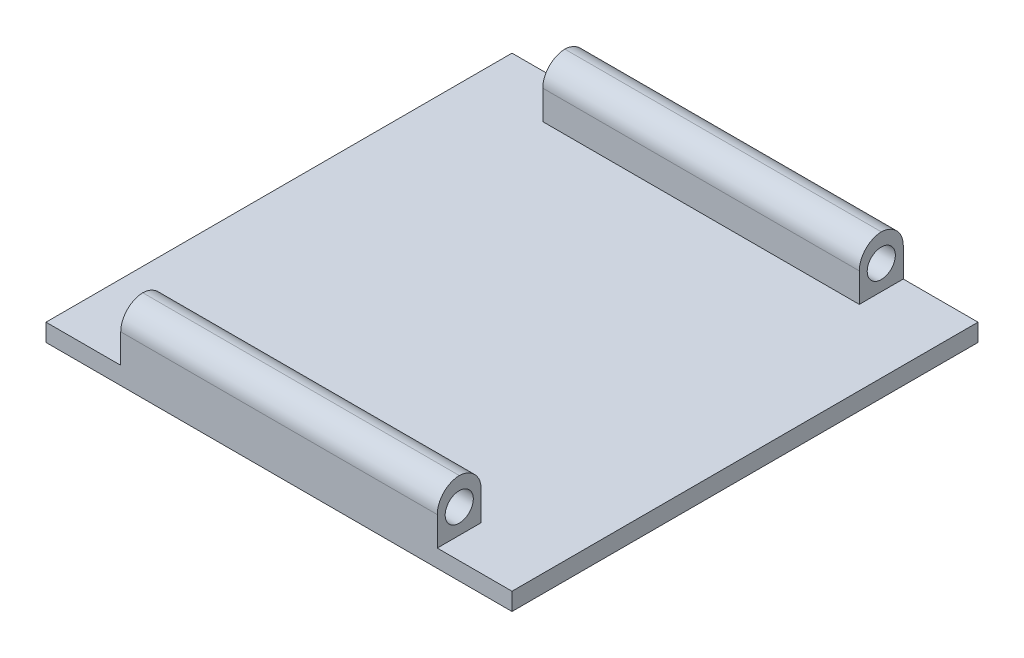
from build123d import *

# Parameters (mm, degrees)
SKETCH1_W           = 53
SKETCH1_H           = 53
BOSS_EXTRUDE1_DEPTH = 2
SKETCH2_W           = 36
SKETCH2_H           = 5
BOSS_EXTRUDE2_DEPTH = 5.9
SKETCH3_R           = 1.6
CUT_EXTRUDE1_DEPTH  = 3.6
CUT_EXTRUDE2_START  = 3.6
SKETCH4_R           = 1.6
CUT_EXTRUDE2_DEPTH  = 3.6
FILLET1_R           = 2.6


with BuildPart() as part:
    # Sketch1 → Boss-Extrude1 (new body)
    with BuildSketch(Plane(origin=(0, 0, 0), x_dir=(1, 0, 0), z_dir=(0, 1, 0))):
        Rectangle(SKETCH1_W, SKETCH1_H)
    extrude(amount=BOSS_EXTRUDE1_DEPTH)

    # Sketch2 → Boss-Extrude2 (add)
    with BuildSketch(Plane(origin=(0, 2, 0), x_dir=(1, 0, 0), z_dir=(0, 1, 0))):
        with Locations((0, 24)):
            Rectangle(SKETCH2_W, SKETCH2_H)
        with Locations((0, -24)):
            Rectangle(SKETCH2_W, SKETCH2_H)
    extrude(amount=BOSS_EXTRUDE2_DEPTH)

    # Sketch3 → Cut-Extrude1 (cut)
    with BuildSketch(Plane(origin=(18, 0, 0), x_dir=(0, 0, -1), z_dir=(1, 0, 0))):
        with Locations((-24, 4.8)):
            Circle(SKETCH3_R)
        with Locations(Location((24, 4.8, 0), (0, 0, 180))):
            Circle(SKETCH3_R)
    extrude(amount=-CUT_EXTRUDE1_DEPTH, mode=Mode.SUBTRACT)

    # Sketch4 → Cut-Extrude2 (cut)
    with BuildSketch(Plane(origin=(-18, 0, -18), x_dir=(0, 0, -1), z_dir=(1, 0, 0)).offset(CUT_EXTRUDE2_START)):
        with Locations((-42, 4.8)):
            Circle(SKETCH4_R)
        with Locations(Location((6, 4.8, 0), (0, 0, 180))):
            Circle(SKETCH4_R)
    extrude(amount=-CUT_EXTRUDE2_DEPTH, mode=Mode.SUBTRACT)

    # Fillet1
    # the kernel refuses this fillet: 2.6 mm, written as the material it takes off along each edge
    with BuildSketch(Plane(origin=(-24.5, 7.9, -26.5), x_dir=(0, -1, 0), z_dir=(1, 0, 0)), Plane(origin=(24.5, 7.9, -21.5), x_dir=(0, -1, 0), z_dir=(-1, 0, 0)), Plane(origin=(24.5, 7.9, 26.5), x_dir=(0, -1, 0), z_dir=(-1, 0, 0))) as fillet1_piece_1:
        with BuildLine():
            CenterArc((FILLET1_R, -FILLET1_R), FILLET1_R, 90, 90)
            Line((0, -FILLET1_R), (0, 0))
            Line((0, 0), (FILLET1_R, 0))
        make_face()
    extrude(amount=49, mode=Mode.SUBTRACT)
    with BuildSketch(Plane(origin=(-24.5, 7.9, 21.5), x_dir=(0, 0, 1), z_dir=(1, 0, 0))) as fillet1_piece_2:
        with BuildLine():
            CenterArc((FILLET1_R, FILLET1_R), FILLET1_R, 180, 90)
            Line((0, FILLET1_R), (0, 0))
            Line((0, 0), (FILLET1_R, 0))
        make_face()
    extrude(amount=49, mode=Mode.SUBTRACT)


solid = part.part
